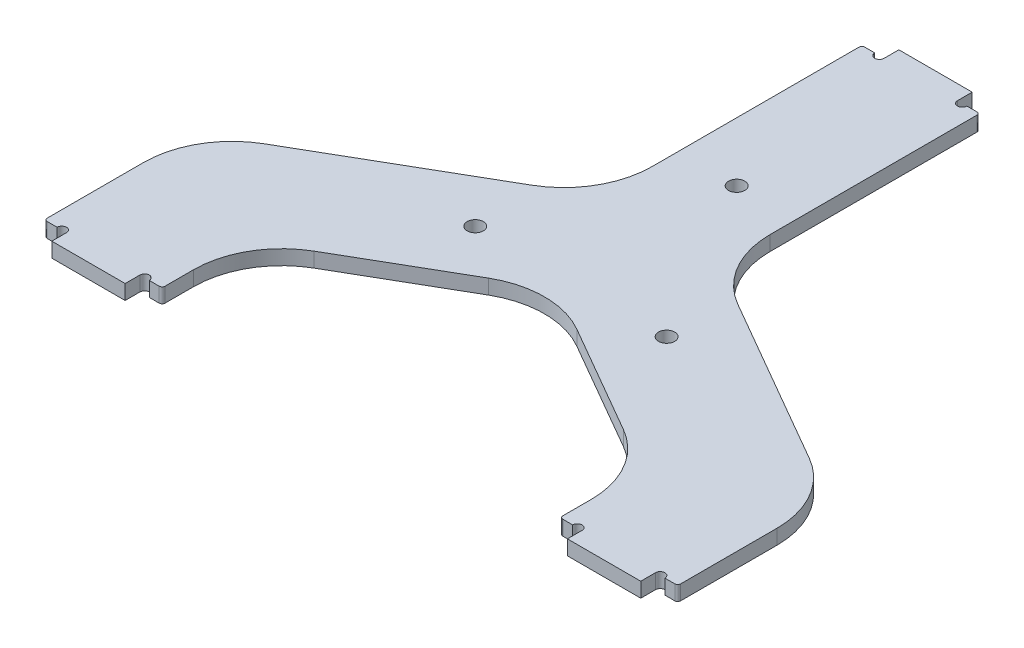
from build123d import *

# Parameters (mm, degrees)
EXTRUDE_1_DEPTH     = 5
SKETCH_3_R          = 2.75
CUT_EXTRUDE_1_DEPTH = 5
SKETCH_4_W          = 25
SKETCH_4_H          = 5
EXTRUDE_2_DEPTH     = 5
SKETCH_5_R          = 1.55
CUT_EXTRUDE_2_DEPTH = 5
FILLET_1_R          = 30
FILLET_2_R          = 1
MOVE_FACE_1_BY      = 0.05
MOVE_FACE_1_2_BY    = 0.05
MOVE_FACE_1_3_BY    = 0.05
MOVE_FACE_1_4_BY    = 0.05
MOVE_FACE_1_5_BY    = 0.05
MOVE_FACE_1_6_BY    = 0.05
MOVE_FACE_1_7_BY    = 0.05
MOVE_FACE_1_8_BY    = 0.05
MOVE_FACE_1_9_BY    = 0.05
MOVE_FACE_1_10_BY   = 0.05
MOVE_FACE_1_11_BY   = 0.05
MOVE_FACE_1_12_BY   = 0.05


with BuildPart() as part:
    # 草图1 → 凸台-拉伸1 (new body)
    with BuildSketch(Plane(origin=(0, 0, 0), x_dir=(1, 0, 0), z_dir=(0, 1, 0))):
        Polygon((-20, 100), (20, 100), (20, 11.547005384), (87.5, -27.424137787), (107.5, -38.97114317), (107.5, -90), (67.5, -90), (67.5, -62.065153938), (0, -23.094010768), (-67.5, -62.065153938), (-67.5, -90), (-107.5, -90), (-107.5, -38.97114317), (-87.5, -27.424137787), (-20, 11.547005384), align=None)
    extrude(amount=EXTRUDE_1_DEPTH)

    # 草图3 → 切除-拉伸1 (cut)
    with BuildSketch(Plane(origin=(0, 5, 0), x_dir=(1, 0, 0), z_dir=(0, 1, 0))):
        with Locations((0, 37.498899984)):
            Circle(SKETCH_3_R)
        with Locations((32.475, -18.749449992)):
            Circle(SKETCH_3_R)
        with Locations((-32.475, -18.749449992)):
            Circle(SKETCH_3_R)
    extrude(amount=-CUT_EXTRUDE_1_DEPTH, mode=Mode.SUBTRACT)

    # 草图4 → 凸台-拉伸2 (add)
    with BuildSketch(Plane(origin=(0, 5, 0), x_dir=(1, 0, 0), z_dir=(0, 1, 0))):
        with Locations((0, 102.5)):
            Rectangle(SKETCH_4_W, SKETCH_4_H)
        with Locations((87.5, -92.5)):
            Rectangle(SKETCH_4_W, SKETCH_4_H)
        with Locations((-87.5, -92.5)):
            Rectangle(SKETCH_4_W, SKETCH_4_H)
    extrude(amount=-EXTRUDE_2_DEPTH)

    # 草图5 → 切除-拉伸2 (cut)
    with BuildSketch(Plane(origin=(0, 5, 0), x_dir=(1, 0, 0), z_dir=(0, 1, 0))):
        with Locations((14.05, 100)):
            Circle(SKETCH_5_R)
        with Locations((-14.05, 100)):
            Circle(SKETCH_5_R)
        with Locations((-73.45, -90)):
            Circle(SKETCH_5_R)
        with Locations((-101.55, -90)):
            Circle(SKETCH_5_R)
        with Locations((101.55, -90)):
            Circle(SKETCH_5_R)
        with Locations((73.45, -90)):
            Circle(SKETCH_5_R)
    extrude(amount=-CUT_EXTRUDE_2_DEPTH, mode=Mode.SUBTRACT)

    # 圆角1
    fillet_1_edges = [part.edges().sort_by_distance(p)[0] for p in [
        (-107.5, 2.5, 38.97114317),
        (-67.5, 2.5, 62.065153938),
        (67.5, 2.5, 62.065153938),
        (107.5, 2.5, 38.97114317),
        (20, 2.5, -11.547005384),
        (0, 2.5, 23.094010768),
        (-20, 2.5, -11.547005384),
    ]]
    fillet(fillet_1_edges, radius=FILLET_1_R)

    # 圆角2
    fillet_2_edges = [part.edges().sort_by_distance(p)[0] for p in [
        (-67.5, 2.5, 90),
        (-107.5, 2.5, 90),
        (67.5, 2.5, 90),
        (107.5, 2.5, 90),
        (-20, 2.5, -100),
        (20, 2.5, -100),
    ]]
    fillet(fillet_2_edges, radius=FILLET_2_R)

    # Move Face 1: a curved face moved inward by 0.05
    add(Solid.thicken(part.faces().sort_by_distance((14.05, 2.5, -98.45))[0], -MOVE_FACE_1_BY), mode=Mode.SUBTRACT)

    # Move Face 1 2: a face moved inward by 0.05
    extrude(part.faces().sort_by_distance((12.5, 2.5, -102.5))[0], amount=MOVE_FACE_1_2_BY, dir=(-1, 0, 0), mode=Mode.SUBTRACT)

    # Move Face 1 3: a curved face moved inward by 0.05
    add(Solid.thicken(part.faces().sort_by_distance((-14.05, 2.5, -98.45))[0], -MOVE_FACE_1_3_BY), mode=Mode.SUBTRACT)

    # Move Face 1 4: a face moved inward by 0.05
    extrude(part.faces().sort_by_distance((-12.5, 2.5, -102.5))[0], amount=MOVE_FACE_1_4_BY, dir=(1, 0, 0), mode=Mode.SUBTRACT)

    # Move Face 1 5: a face moved inward by 0.05
    extrude(part.faces().sort_by_distance((-100, 2.5, 92.5))[0], amount=MOVE_FACE_1_5_BY, dir=(1, 0, 0), mode=Mode.SUBTRACT)

    # Move Face 1 6: a curved face moved inward by 0.05
    add(Solid.thicken(part.faces().sort_by_distance((-101.55, 2.5, 88.45))[0], -MOVE_FACE_1_6_BY), mode=Mode.SUBTRACT)

    # Move Face 1 7: a face moved inward by 0.05
    extrude(part.faces().sort_by_distance((-75, 2.5, 92.5))[0], amount=MOVE_FACE_1_7_BY, dir=(-1, 0, 0), mode=Mode.SUBTRACT)

    # Move Face 1 8: a curved face moved inward by 0.05
    add(Solid.thicken(part.faces().sort_by_distance((-73.45, 2.5, 88.45))[0], -MOVE_FACE_1_8_BY), mode=Mode.SUBTRACT)

    # Move Face 1 9: a face moved inward by 0.05
    extrude(part.faces().sort_by_distance((100, 2.5, 92.5))[0], amount=MOVE_FACE_1_9_BY, dir=(-1, 0, 0), mode=Mode.SUBTRACT)

    # Move Face 1 10: a curved face moved inward by 0.05
    add(Solid.thicken(part.faces().sort_by_distance((101.55, 2.5, 88.45))[0], -MOVE_FACE_1_10_BY), mode=Mode.SUBTRACT)

    # Move Face 1 11: a face moved inward by 0.05
    extrude(part.faces().sort_by_distance((75, 2.5, 92.5))[0], amount=MOVE_FACE_1_11_BY, dir=(1, 0, 0), mode=Mode.SUBTRACT)

    # Move Face 1 12: a curved face moved inward by 0.05
    add(Solid.thicken(part.faces().sort_by_distance((73.45, 2.5, 88.45))[0], -MOVE_FACE_1_12_BY), mode=Mode.SUBTRACT)


solid = part.part
